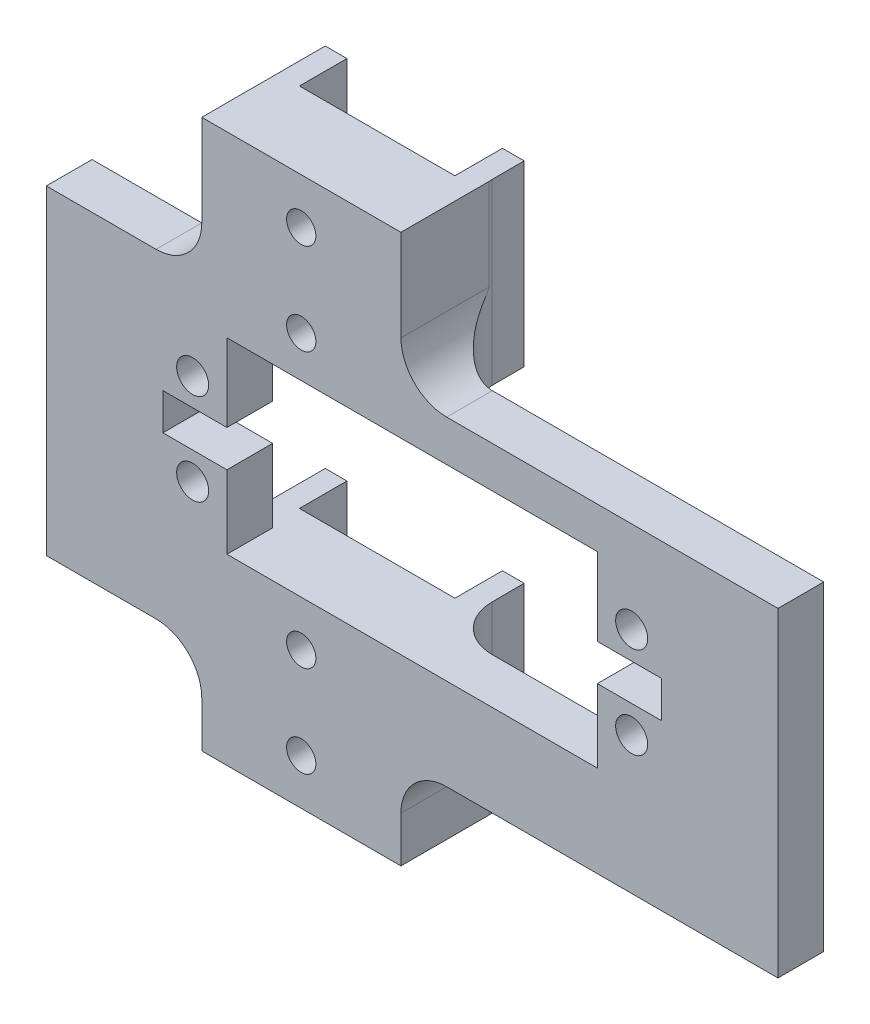
from build123d import *
from OCP.BRepAlgoAPI import BRepAlgoAPI_Cut
from OCP.TopTools import TopTools_ListOfShape

# Parameters (mm, degrees)
SKETCH_1_R               = 1.75
EXTRUDE_1_DEPTH          = 5
SKETCH_2_W               = 3
SKETCH_2_H               = 10
EXTRUDE_2_DEPTH          = 8.5
SKETCH_3_W               = 15.75
SKETCH_3_H               = 3.3
EXTRUDE_3_DEPTH          = 10
EXTRUDE_4_DEPTH          = 30
SKETCH_6_W               = 21.776428499
SKETCH_6_H               = 20.5
CUT_EXTRUDE_2_DEPTH      = 43.582273307
SKETCH_7_W               = 58
SKETCH_7_H               = 5
EXTRUDE_5_DEPTH          = 5
SKETCH_8_W               = 40.5
SKETCH_8_H               = 0.5
CUT_EXTRUDE_3_DEPTH      = 44.854874301
SKETCH_9_W               = 21.776428499
SKETCH_9_H               = 15
SKETCH_9_H_2             = 10
EXTRUDE_6_DEPTH          = 5
FILLET_1_R               = 5
SKETCH_10_R              = 1.6
CUT_EXTRUDE_4_DEPTH      = 43.542801976
FILLET_START             = 10.5
FILLET_2_DEPTH           = 9.5
FILLET_START_2           = 19.239089818
FILLET_2_2_DEPTH         = 10.760910182
FILLET_START_3           = -4.606326438
FILLET_2_3_DEPTH         = 4.606326438
FILLET_START_4           = -19.9999999
FILLET_3_DEPTH           = 9.9999999
FILLET_START_5           = -30
FILLET_3_2_DEPTH         = 17.8876
FILLET_START_6           = -4.606334035
FILLET_3_3_DEPTH         = 4.606334035
FILLET_START_7           = -25
FILLET_3_4_DEPTH         = 5
FILLET_START_8           = -20.000021607
FILLET_3_5_DEPTH         = 2.1607e-05
SKETCH_11_W              = 11
SKETCH_11_H              = 35
EXTRUDE_7_DEPTH          = 5
SKETCH_12_W              = 10
SKETCH_12_H              = 10
EXTRUDE_8_DEPTH          = 5
SKETCH_14_W              = 0.625
SKETCH_14_H              = 60
CUT_EXTRUDE_5_DEPTH      = 5.2
SKETCH_15_W              = 10
SKETCH_15_H              = 10
CUT_EXTRUDE_6_DEPTH      = 10
CUT_EXTRUDE_7_DEPTH      = 51.717354032
CUT_EXTRUDE_7_DEPTH_BACK = 51.717354032
SKETCH_16_W              = 7
SKETCH_16_H              = 4


with BuildPart() as part:
    # ｽｹｯﾁ1 → ﾎﾞｽ - 押し出し1 (new body)
    with BuildSketch(Plane.XY):
        Polygon((-20.25, 10), (-20.25, -10), (20.25, -10), (20.25, 10), (29, 10), (29, -20), (-29, -20), (-29, 10), align=None)
        with Locations((-24, 5)):
            Circle(SKETCH_1_R, mode=Mode.SUBTRACT)
        with Locations((-24, -5)):
            Circle(SKETCH_1_R, mode=Mode.SUBTRACT)
        with Locations((24, 5)):
            Circle(SKETCH_1_R, mode=Mode.SUBTRACT)
        with Locations((24, -5)):
            Circle(SKETCH_1_R, mode=Mode.SUBTRACT)
    extrude(amount=EXTRUDE_1_DEPTH)

    # ｽｹｯﾁ2 → ﾎﾞｽ - 押し出し2 (add)
    with BuildSketch(Plane(origin=(0, 0, 0), x_dir=(-1, 0, 0), z_dir=(0, 0, -1))):
        with Locations((21.5, -15)):
            Rectangle(SKETCH_2_W, SKETCH_2_H)
        with Locations((2.75, -15)):
            Rectangle(SKETCH_2_W, SKETCH_2_H)
    extrude(amount=EXTRUDE_2_DEPTH)

    # ｽｹｯﾁ3 → ﾎﾞｽ - 押し出し3 (add)
    with BuildSketch(Plane(origin=(0, -10, 0), x_dir=(1, 0, 0), z_dir=(0, 1, 0))):
        with Locations((-12.125, 1.65)):
            Rectangle(SKETCH_3_W, SKETCH_3_H)
    extrude(amount=-EXTRUDE_3_DEPTH)

    # ｽｹｯﾁ4 → ﾎﾞｽ - 押し出し4 (add, symmetric)
    with BuildSketch(Plane(origin=(0, 0, 0), x_dir=(1, 0, 0), z_dir=(0, 1, 0))):
        Polygon((-23, 8.5), (-23, 0), (-1.223571501, 0), (-1.25, 8.5), (-4.25, 8.5), (-4.25, 3.3), (-20, 3.3), (-20, 8.5), align=None)
    extrude(amount=EXTRUDE_4_DEPTH, both=True)

    # ｽｹｯﾁ6 → ｶｯﾄ - 押し出し2 (cut, through all)
    with BuildSketch(Plane.XY):
        with Locations((-12.11178575, 0.25)):
            Rectangle(SKETCH_6_W, SKETCH_6_H)
    extrude(amount=-CUT_EXTRUDE_2_DEPTH, mode=Mode.SUBTRACT)


with BuildPart() as cut_extrude_2_piece_1:
    # of the separate pieces the step leaves, piece 1, a body of its own (cut_extrude_2_pieces)
    add(part.part.solids().sort_by_distance((-20.25, 10, 0))[0])



with BuildPart() as cut_extrude_2_piece_2:
    # of the separate pieces the step leaves, piece 2, a body of its own (cut_extrude_2_pieces)
    add(part.part.solids().sort_by_distance((-23, 10.5, 0))[0])


with BuildPart() as cut_extrude_2_piece_1_1:
    add(cut_extrude_2_piece_1.part)

    add(cut_extrude_2_piece_2.part)  # ﾎﾞｽ - 押し出し5 merges ｶｯﾄ - 押し出し2 piece 2
    # ｽｹｯﾁ7 → ﾎﾞｽ - 押し出し5 (add)
    with BuildSketch(Plane.XY.offset(5)):
        with Locations((0, 12.5)):
            Rectangle(SKETCH_7_W, SKETCH_7_H)
    extrude(amount=-EXTRUDE_5_DEPTH)

    # ｽｹｯﾁ8 → ｶｯﾄ - 押し出し3 (cut, through all)
    with BuildSketch(Plane.XY.offset(5)):
        with Locations((0, 10.25)):
            Rectangle(SKETCH_8_W, SKETCH_8_H)
    extrude(amount=-CUT_EXTRUDE_3_DEPTH, mode=Mode.SUBTRACT)

    # ｽｹｯﾁ9 → ﾎﾞｽ - 押し出し6 (add)
    with BuildSketch(Plane.XY):
        with Locations((-12.11178575, 22.5)):
            Rectangle(SKETCH_9_W, SKETCH_9_H)
        with Locations((-12.11178575, -25)):
            Rectangle(SKETCH_9_W, SKETCH_9_H_2)
    extrude(amount=EXTRUDE_6_DEPTH)

    # ﾌｨﾚｯﾄ1
    # the kernel refuses this fillet: 5 mm, written as the material it adds along each edge
    with BuildSketch(Plane(origin=(-23, 15, 0), x_dir=(-1, 0, 0), z_dir=(0, 0, 1))) as fillet_1_piece_1:
        with BuildLine():
            CenterArc((FILLET_1_R, -FILLET_1_R), FILLET_1_R, 90, 90)
            Line((0, -FILLET_1_R), (0, 0))
            Line((0, 0), (FILLET_1_R, 0))
        make_face()
    extrude(amount=5)
    with BuildSketch(Plane(origin=(-1.223571501, 15, 0), x_dir=(1, 0, 0), z_dir=(0, 0, 1))) as fillet_1_piece_2_section:
        with BuildLine():
            CenterArc((FILLET_1_R, FILLET_1_R), FILLET_1_R, 180, 90)
            Line((0, FILLET_1_R), (0, 0))
            Line((0, 0), (FILLET_1_R, 0))
        make_face()
    fillet_1_piece_2 = extrude(amount=5, mode=Mode.PRIVATE)
    fillet_1_piece_2 = split(fillet_1_piece_2, bisect_by=Plane(origin=(-1.223571501, 15, 0), z_dir=(0.9999951663633728, 0, -0.003109220141828846)), keep=Keep.TOP, mode=Mode.PRIVATE)
    add(fillet_1_piece_2)
    with BuildSketch(Plane(origin=(-1.223571501, 15, 0), x_dir=(1, 0, 0), z_dir=(0, 0, 1))) as fillet_1_piece_3_section:
        with BuildLine():
            CenterArc((FILLET_1_R, FILLET_1_R), FILLET_1_R, 180, 90)
            Line((0, FILLET_1_R), (0, 0))
            Line((0, 0), (FILLET_1_R, 0))
        make_face()
    fillet_1_piece_3 = extrude(amount=5, mode=Mode.PRIVATE)
    fillet_1_piece_3 = split(fillet_1_piece_3, bisect_by=Plane(origin=(-1.223571501, 15, 0), z_dir=(-0.9999951663633728, 0, 0.003109220141828846)), keep=Keep.TOP, mode=Mode.PRIVATE)
    add(fillet_1_piece_3)
    with BuildSketch(Plane(origin=(-1.223571501, -20, 0), x_dir=(1, 0, 0), z_dir=(0, 0, 1))) as fillet_1_piece_4_section:
        with BuildLine():
            CenterArc((FILLET_1_R, -FILLET_1_R), FILLET_1_R, 90, 90)
            Line((0, -FILLET_1_R), (0, 0))
            Line((0, 0), (FILLET_1_R, 0))
        make_face()
    fillet_1_piece_4 = extrude(amount=5, mode=Mode.PRIVATE)
    fillet_1_piece_4 = split(fillet_1_piece_4, bisect_by=Plane(origin=(-1.223571501, -20, 0), z_dir=(0.9999951663633728, 0, -0.003109220141828846)), keep=Keep.TOP, mode=Mode.PRIVATE)
    add(fillet_1_piece_4)
    with BuildSketch(Plane(origin=(-1.223571501, -20, 0), x_dir=(1, 0, 0), z_dir=(0, 0, 1))) as fillet_1_piece_5_section:
        with BuildLine():
            CenterArc((FILLET_1_R, -FILLET_1_R), FILLET_1_R, 90, 90)
            Line((0, -FILLET_1_R), (0, 0))
            Line((0, 0), (FILLET_1_R, 0))
        make_face()
    fillet_1_piece_5 = extrude(amount=5, mode=Mode.PRIVATE)
    fillet_1_piece_5 = split(fillet_1_piece_5, bisect_by=Plane(origin=(-1.223571501, -20, 0), z_dir=(-0.9999951663633728, 0, 0.003109220141828846)), keep=Keep.TOP, mode=Mode.PRIVATE)
    add(fillet_1_piece_5)
    with BuildSketch(Plane(origin=(-23, -20, 0), x_dir=(-1, 0, 0), z_dir=(0, 0, 1))) as fillet_1_piece_6:
        with BuildLine():
            CenterArc((FILLET_1_R, FILLET_1_R), FILLET_1_R, 180, 90)
            Line((0, FILLET_1_R), (0, 0))
            Line((0, 0), (FILLET_1_R, 0))
        make_face()
    extrude(amount=5)

    # ｽｹｯﾁ10 → ｶｯﾄ - 押し出し4 (cut, through all)
    with BuildSketch(Plane(origin=(0, 0, -3.3), x_dir=(-1, 0, 0), z_dir=(0, 0, -1))):
        with Locations((12.125, 25)):
            Circle(SKETCH_10_R)
        with Locations((12.125, 15)):
            Circle(SKETCH_10_R)
        with Locations((12.125, -15)):
            Circle(SKETCH_10_R)
        with Locations((12.125, -25)):
            Circle(SKETCH_10_R)
    extrude(amount=-CUT_EXTRUDE_4_DEPTH, mode=Mode.SUBTRACT)

    # ﾌｨﾚｯﾄ2: read off the stored shape, not the designer's step
    # ﾌｨﾚｯﾄ2 outline → ﾌｨﾚｯﾄ2 (add)
    with BuildSketch(Plane(origin=(0, 0, 0), x_dir=(1, 0, 0), z_dir=(0, 1, 0)).offset(FILLET_START)):
        with BuildLine():
            ThreePointArc((3.760906491, 0), (0.230873241, 1.458973983), (-1.23906934, 4.984453899))
            Line((-1.23906934, 4.984453899), (-1.223571501, 0))
            Line((-1.223571501, 0), (3.760906491, 0))
        make_face()
    extrude(amount=FILLET_2_DEPTH)

    # Fillet 2 2 outline → Fillet 2 2 (add)
    with BuildSketch(Plane(origin=(0, 0, 0), x_dir=(1, 0, 0), z_dir=(0, 1, 0)).offset(FILLET_START_2)):
        with BuildLine():
            Line((-1.223571501, 0), (-1.223571501, 4.606326096))
            ThreePointArc((-1.223571501, 4.606326096), (-1.234899219, 4.795243318), (-1.23906934, 4.984453899))
            Line((-1.23906934, 4.984453899), (-1.223571501, 0))
        make_face()
    extrude(amount=FILLET_2_2_DEPTH)

    # Fillet 2 3 outline → Fillet 2 3 (cut)
    with BuildSketch(Plane.XY.offset(FILLET_START_3)):
        with BuildLine():
            ThreePointArc((-1.223571501, 20), (0.240894593, 16.464466094), (3.776428499, 15))
            Line((3.776428499, 15), (5, 15))
            Line((5, 15), (5, 20))
            Line((5, 20), (-1.223571501, 20))
        make_face()
    extrude(amount=FILLET_2_3_DEPTH, mode=Mode.SUBTRACT)


with BuildPart() as fillet_3_tool:
    # ﾌｨﾚｯﾄ3: read off the stored shape, not the designer's step
    # ﾌｨﾚｯﾄ3 outline → ﾌｨﾚｯﾄ3 (new body)
    with BuildSketch(Plane(origin=(0, 0, 0), x_dir=(1, 0, 0), z_dir=(0, 1, 0)).offset(FILLET_START_4)):
        with BuildLine():
            ThreePointArc((3.760906491, 0), (0.230873241, 1.458973983), (-1.23906934, 4.984453899))
            Line((-1.23906934, 4.984453899), (-1.223571501, 0))
            Line((-1.223571501, 0), (3.760906491, 0))
        make_face()
    extrude(amount=FILLET_3_DEPTH)


with BuildPart() as cut_extrude_2_piece_1_2:
    add(cut_extrude_2_piece_1_1.part)


with BuildPart() as cut_extrude_2_piece_1_3:
    # ﾌｨﾚｯﾄ3: joined with fillet_3_tool
    add(cut_extrude_2_piece_1_2.part.fuse(fillet_3_tool.part, tol=0.00001))


with BuildPart() as fillet_3_2_tool:
    # Fillet 3 2 outline → Fillet 3 2 (new body)
    with BuildSketch(Plane(origin=(0, 0, 0), x_dir=(1, 0, 0), z_dir=(0, 1, 0)).offset(FILLET_START_5)):
        with BuildLine():
            Line((-1.223571501, 0), (-1.223571501, 4.606326096))
            ThreePointArc((-1.223571501, 4.606326096), (-1.234899219, 4.795243318), (-1.23906934, 4.984453899))
            Line((-1.23906934, 4.984453899), (-1.223571501, 0))
        make_face()
    extrude(amount=FILLET_3_2_DEPTH)


with BuildPart() as cut_extrude_2_piece_1_4:
    add(cut_extrude_2_piece_1_3.part)


with BuildPart() as cut_extrude_2_piece_1_5:
    # Fillet 3 2: joined with fillet_3_2_tool
    add(cut_extrude_2_piece_1_4.part.fuse(fillet_3_2_tool.part, tol=0.00001))


with BuildPart() as fillet_3_3_tool:
    # Fillet 3 3 outline → Fillet 3 3 (new body)
    with BuildSketch(Plane.XY.offset(FILLET_START_6)):
        with BuildLine():
            ThreePointArc((-1.223571501, -25), (0.235411013, -21.469958192), (3.760906566, -20.000024093))
            Line((3.760906566, -20.000024093), (-1.223571501, -19.9999999))
            Line((-1.223571501, -19.9999999), (-1.223571501, -25))
        make_face()
    extrude(amount=FILLET_3_3_DEPTH)


with BuildPart() as cut_extrude_2_piece_1_6:
    add(cut_extrude_2_piece_1_5.part)


with BuildPart() as cut_extrude_2_piece_1_7:
    # Fillet 3 3: joined with fillet_3_3_tool
    add(cut_extrude_2_piece_1_6.part.fuse(fillet_3_3_tool.part, tol=0.00001))


with BuildPart() as fillet_3_4_tool:
    # Fillet 3 4 outline → Fillet 3 4 (new body)
    with BuildSketch(Plane(origin=(0, 0, 0), x_dir=(1, 0, 0), z_dir=(0, 1, 0)).offset(FILLET_START_7)):
        with BuildLine():
            ThreePointArc((-1.223571501, 4.606326096), (0.367410471, 1.327918198), (3.760906491, 0))
            Line((3.760906491, 0), (3.760906566, 4.606334035))
            Line((3.760906566, 4.606334035), (-1.223571501, 4.606326096))
        make_face()
    extrude(amount=FILLET_3_4_DEPTH)


with BuildPart() as cut_extrude_2_piece_1_8:
    add(cut_extrude_2_piece_1_7.part)

    # Fillet 3 4: cut by fillet_3_4_tool, with a tolerance
    fillet_3_4_stock = TopTools_ListOfShape()
    fillet_3_4_stock.Append(cut_extrude_2_piece_1_8.part.wrapped)
    fillet_3_4_tools = TopTools_ListOfShape()
    fillet_3_4_tools.Append(fillet_3_4_tool.part.wrapped)
    fillet_3_4_cut = BRepAlgoAPI_Cut()
    fillet_3_4_cut.SetArguments(fillet_3_4_stock)
    fillet_3_4_cut.SetTools(fillet_3_4_tools)
    fillet_3_4_cut.SetFuzzyValue(0.00001)
    fillet_3_4_cut.Build()
    add(Compound.cast(fillet_3_4_cut.Shape()).solids(), mode=Mode.REPLACE)


with BuildPart() as fillet_3_5_tool:
    # Fillet 3 5 outline → Fillet 3 5 (new body)
    with BuildSketch(Plane(origin=(0, 0, 0), x_dir=(1, 0, 0), z_dir=(0, 1, 0)).offset(FILLET_START_8)):
        with BuildLine():
            Line((-1.223571501, 0), (3.760906491, 0))
            ThreePointArc((3.760906491, 0), (0.367410471, 1.327918198), (-1.223571501, 4.606326096))
            Line((-1.223571501, 4.606326096), (-1.223571501, 0))
        make_face()
    extrude(amount=FILLET_3_5_DEPTH)


with BuildPart() as cut_extrude_2_piece_1_9:
    add(cut_extrude_2_piece_1_8.part)


with BuildPart() as cut_extrude_2_piece_1_10:
    # Fillet 3 5: joined with fillet_3_5_tool
    add(cut_extrude_2_piece_1_9.part.fuse(fillet_3_5_tool.part, tol=0.00001))

    # ｽｹｯﾁ11 → ﾎﾞｽ - 押し出し7 (add)
    with BuildSketch(Plane.XY.offset(5)):
        with Locations((-34.5, -2.5)):
            Rectangle(SKETCH_11_W, SKETCH_11_H)
        with Locations((34.5, -2.5)):
            Rectangle(SKETCH_11_W, SKETCH_11_H)
    extrude(amount=-EXTRUDE_7_DEPTH)

    # ｽｹｯﾁ12 → ﾎﾞｽ - 押し出し8 (add)
    with BuildSketch(Plane.XZ.offset(20)):
        with Locations((-35, 10)):
            Rectangle(SKETCH_12_W, SKETCH_12_H)
        with Locations((35, 10)):
            Rectangle(SKETCH_12_W, SKETCH_12_H)
    extrude(amount=-EXTRUDE_8_DEPTH)

    # ｽｹｯﾁ14 → ｶｯﾄ - 押し出し5 (cut)
    with BuildSketch(Plane(origin=(0, 0, -8.5), x_dir=(-1, 0, 0), z_dir=(0, 0, -1))):
        with Locations((20.3125, 0)):
            Rectangle(SKETCH_14_W, SKETCH_14_H)
        Polygon((4.25, 30), (3.625, 30), (3.625, 10.5), (3.625, -30), (4.25, -30), (4.25, 10.5), align=None)
    extrude(amount=-CUT_EXTRUDE_5_DEPTH, mode=Mode.SUBTRACT)

    # ｽｹｯﾁ15 → ｶｯﾄ - 押し出し6 (cut)
    with BuildSketch(Plane(origin=(0, -15, 0), x_dir=(1, 0, 0), z_dir=(0, 1, 0))):
        with Locations((-35, -10)):
            Rectangle(SKETCH_15_W, SKETCH_15_H)
        with Locations((35, -10)):
            Rectangle(SKETCH_15_W, SKETCH_15_H)
    extrude(amount=-CUT_EXTRUDE_6_DEPTH, mode=Mode.SUBTRACT)

    # ｽｹｯﾁ16 → ｶｯﾄ - 押し出し7 (cut, two sides: drawn at the far end of the back side and taken through both)
    with BuildSketch(Plane(origin=(0, 0, 0), x_dir=(-1, 0, 0), z_dir=(0, 0, -1)).offset(-CUT_EXTRUDE_7_DEPTH_BACK)):
        with Locations((23.75, 0)):
            Rectangle(SKETCH_16_W, SKETCH_16_H)
        with Locations((-23.75, 0)):
            Rectangle(SKETCH_16_W, SKETCH_16_H)
    extrude(amount=CUT_EXTRUDE_7_DEPTH + CUT_EXTRUDE_7_DEPTH_BACK, mode=Mode.SUBTRACT)


solid = cut_extrude_2_piece_1_10.part
